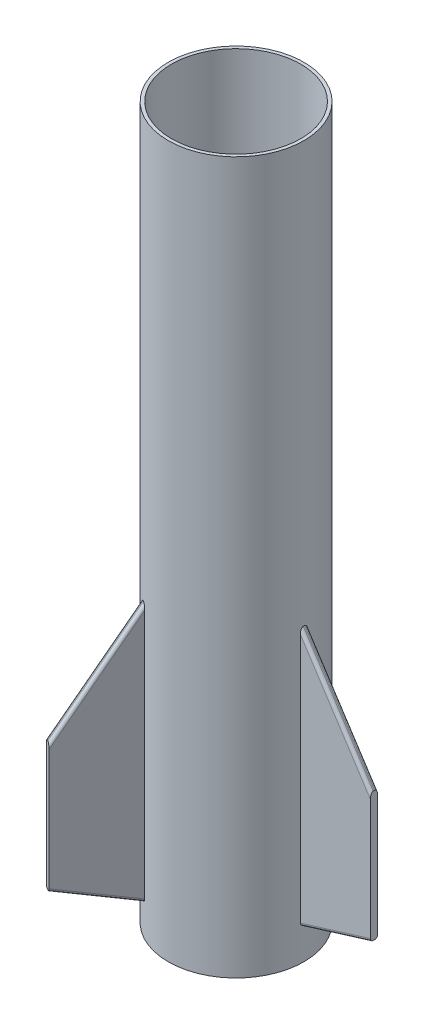
from build123d import *

# Parameters (mm, degrees)
SKETCH3_R                = 40.005
SKETCH3_R_2              = 38.1
BOSS_EXTRUDE1_DEPTH      = 419.1
BOSS_EXTRUDE2_DEPTH      = 2.159
BOSS_EXTRUDE2_DEPTH_BACK = 2.159
FILLET1_R                = 1.778
CIRPATTERN1_COUNT        = 3


with BuildPart() as part:
    # Sketch3 → Boss-Extrude1 (new body)
    with BuildSketch(Plane(origin=(0, 0, 0), x_dir=(1, 0, 0), z_dir=(0, 1, 0))):
        Circle(SKETCH3_R)
        Circle(SKETCH3_R_2, mode=Mode.SUBTRACT)
    extrude(amount=BOSS_EXTRUDE1_DEPTH)


with BuildPart() as body_2:
    # Sketch4 → Boss-Extrude2 (new, two sides: drawn at the far end of the back side and taken through both)
    with BuildSketch(Plane.XY.offset(-BOSS_EXTRUDE2_DEPTH_BACK)):
        Polygon((40.005, 19.05), (40.005, 171.45), (81.28, 107.95), (81.28, 31.75), align=None)
    extrude(amount=BOSS_EXTRUDE2_DEPTH + BOSS_EXTRUDE2_DEPTH_BACK)

    # Fillet1
    fillet1_edges = [body_2.edges().sort_by_distance(p)[0] for p in [
        (60.6425, 25.4, 2.159),
        (60.6425, 25.4, -2.159),
        (60.6425, 139.7, 2.159),
        (60.6425, 139.7, -2.159),
    ]]
    fillet(fillet1_edges, radius=FILLET1_R)


with BuildPart() as cirpattern1_1:
    # CirPattern1: pattern copy
    add(body_2.part.rotate(Axis((0, 0, 0), (0, 1, 0)), 1 * 360 / CIRPATTERN1_COUNT))


with BuildPart() as cirpattern1_2:
    # CirPattern1: pattern copy
    add(body_2.part.rotate(Axis((0, 0, 0), (0, 1, 0)), 2 * 360 / CIRPATTERN1_COUNT))


solid = Compound([part.part, body_2.part, cirpattern1_1.part, cirpattern1_2.part])
